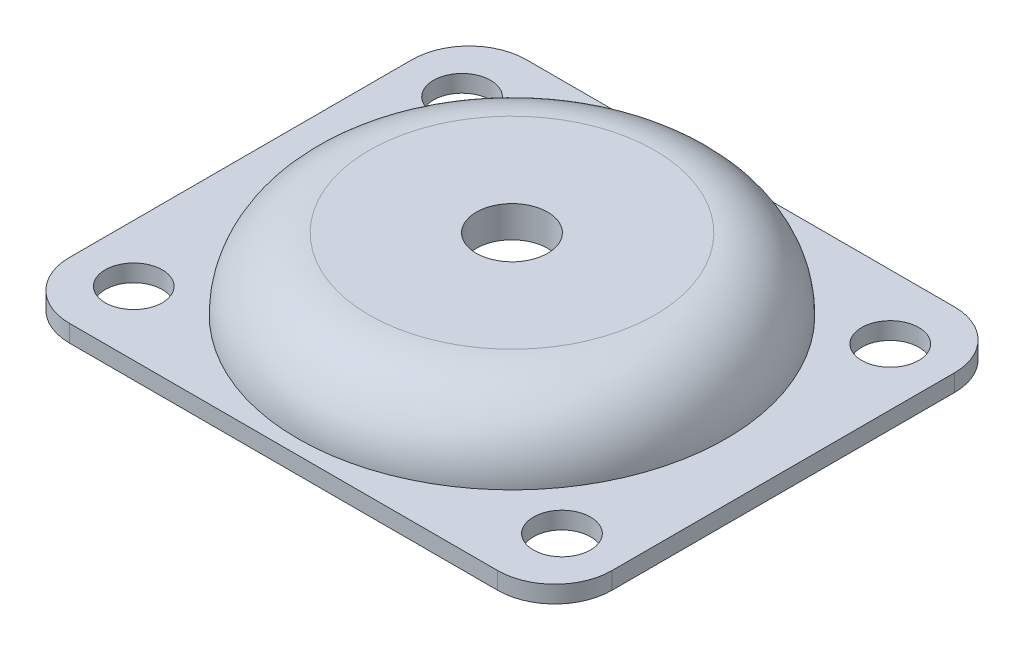
from build123d import *

# Parameters (mm, degrees)
SKIZZE1_W                       = 38
SKIZZE1_H                       = 32
AUFSATZ_LINEAR_AUSTRAGEN1_DEPTH = 1.2
SKIZZE2_R                       = 15
AUFSATZ_LINEAR_AUSTRAGEN2_DEPTH = 5
VERRUNDUNG1_R                   = 5
SCHNITT_LINEAR_AUSTRAGEN1_REACH = 27.338
SKIZZE3_R                       = 2
SKIZZE4_R                       = 14
SCHNITT_LINEAR_AUSTRAGEN2_DEPTH = 4
VERRUNDUNG2_R                   = 4
SKIZZE5_R                       = 2.5
SCHNITT_LINEAR_AUSTRAGEN3_DEPTH = 26.601562452
VERRUNDUNG3_R                   = 4


with BuildPart() as part:
    # Skizze1 → Aufsatz-Linear austragen1 (new body)
    with BuildSketch(Plane(origin=(0, 0, 0), x_dir=(1, 0, 0), z_dir=(0, 1, 0))):
        Rectangle(SKIZZE1_W, SKIZZE1_H)
    extrude(amount=AUFSATZ_LINEAR_AUSTRAGEN1_DEPTH)

    # Skizze2 → Aufsatz-Linear austragen2 (add)
    with BuildSketch(Plane(origin=(0, 1.2, 0), x_dir=(1, 0, 0), z_dir=(0, 1, 0))):
        with Locations(Location((0, 0, 0), (0, 0, 270))):
            Circle(SKIZZE2_R)
    extrude(amount=AUFSATZ_LINEAR_AUSTRAGEN2_DEPTH)

    # Verrundung1
    verrundung1_edges = [part.edges().sort_by_distance(p)[0] for p in [
        (0, 6.2, -15),
    ]]
    fillet(verrundung1_edges, radius=VERRUNDUNG1_R - 0.0001)  # a hair under: the kernel refuses the full size

    # Skizze3 → Schnitt-Linear austragen1 (cut, up to next)
    with BuildSketch(Plane(origin=(0, 1.2, 0), x_dir=(1, 0, 0), z_dir=(0, 1, 0)), mode=Mode.PRIVATE) as schnitt_linear_austragen1_sk1:
        with Locations(Location((-15, 11.5, 0), (0, 0, 270))):
            Circle(SKIZZE3_R)
    schnitt_linear_austragen1_tool1 = extrude(schnitt_linear_austragen1_sk1.sketch, amount=-SCHNITT_LINEAR_AUSTRAGEN1_REACH, mode=Mode.PRIVATE) & part.part
    # Skizze3 → Schnitt-Linear austragen1 (cut, up to next)
    with BuildSketch(Plane(origin=(0, 1.2, 0), x_dir=(1, 0, 0), z_dir=(0, 1, 0)), mode=Mode.PRIVATE) as schnitt_linear_austragen1_sk2:
        with Locations(Location((15, 11.5, 0), (0, 0, 270))):
            Circle(SKIZZE3_R)
    schnitt_linear_austragen1_tool2 = extrude(schnitt_linear_austragen1_sk2.sketch, amount=-SCHNITT_LINEAR_AUSTRAGEN1_REACH, mode=Mode.PRIVATE) & part.part
    # Skizze3 → Schnitt-Linear austragen1 (cut, up to next)
    with BuildSketch(Plane(origin=(0, 1.2, 0), x_dir=(1, 0, 0), z_dir=(0, 1, 0)), mode=Mode.PRIVATE) as schnitt_linear_austragen1_sk3:
        with Locations(Location((15, -11.5, 0), (0, 0, 270))):
            Circle(SKIZZE3_R)
    schnitt_linear_austragen1_tool3 = extrude(schnitt_linear_austragen1_sk3.sketch, amount=-SCHNITT_LINEAR_AUSTRAGEN1_REACH, mode=Mode.PRIVATE) & part.part
    # Skizze3 → Schnitt-Linear austragen1 (cut, up to next)
    with BuildSketch(Plane(origin=(0, 1.2, 0), x_dir=(1, 0, 0), z_dir=(0, 1, 0)), mode=Mode.PRIVATE) as schnitt_linear_austragen1_sk4:
        with Locations(Location((-15, -11.5, 0), (0, 0, 270))):
            Circle(SKIZZE3_R)
    schnitt_linear_austragen1_tool4 = extrude(schnitt_linear_austragen1_sk4.sketch, amount=-SCHNITT_LINEAR_AUSTRAGEN1_REACH, mode=Mode.PRIVATE) & part.part
    add(schnitt_linear_austragen1_tool1.solids().sort_by_distance((-15, 1.2, -11.5))[0], mode=Mode.SUBTRACT)
    add(schnitt_linear_austragen1_tool2.solids().sort_by_distance((15, 1.2, -11.5))[0], mode=Mode.SUBTRACT)
    add(schnitt_linear_austragen1_tool3.solids().sort_by_distance((15, 1.2, 11.5))[0], mode=Mode.SUBTRACT)
    add(schnitt_linear_austragen1_tool4.solids().sort_by_distance((-15, 1.2, 11.5))[0], mode=Mode.SUBTRACT)

    # Skizze4 → Schnitt-Linear austragen2 (cut)
    with BuildSketch(Plane.XZ):
        with Locations(Location((0, 0, 0), (0, 0, 270))):
            Circle(SKIZZE4_R)
    extrude(amount=-SCHNITT_LINEAR_AUSTRAGEN2_DEPTH, mode=Mode.SUBTRACT)

    # Verrundung2
    verrundung2_edges = [part.edges().sort_by_distance(p)[0] for p in [
        (0, 4, 14),
    ]]
    fillet(verrundung2_edges, radius=VERRUNDUNG2_R - 0.0001)  # a hair under: the kernel refuses the full size

    # Skizze5 → Schnitt-Linear austragen3 (cut, through all)
    with BuildSketch(Plane(origin=(0, 6.2, 0), x_dir=(1, 0, 0), z_dir=(0, 1, 0))):
        with Locations(Location((0, 0, 0), (0, 0, 270))):
            Circle(SKIZZE5_R)
    extrude(amount=-SCHNITT_LINEAR_AUSTRAGEN3_DEPTH, mode=Mode.SUBTRACT)

    # Verrundung3
    verrundung3_edges = [part.edges().sort_by_distance(p)[0] for p in [
        (19, 0.6, 16),
        (-19, 0.6, 16),
        (-19, 0.6, -16),
        (19, 0.6, -16),
    ]]
    fillet(verrundung3_edges, radius=VERRUNDUNG3_R)


solid = part.part
